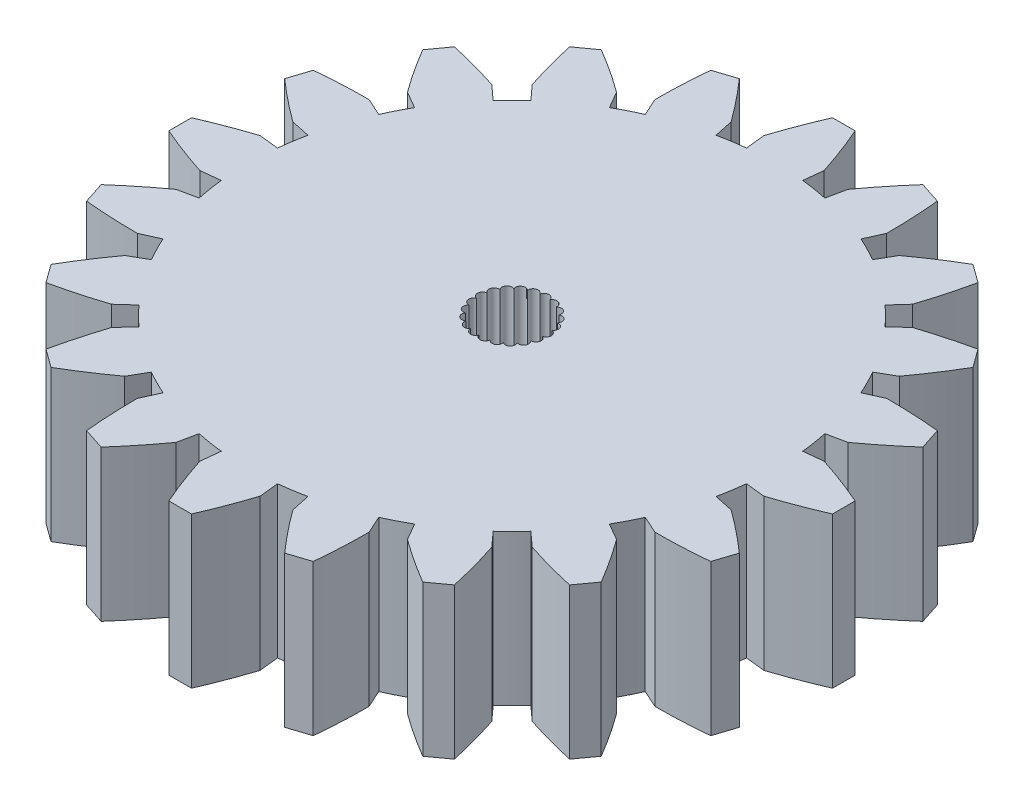
from build123d import *

# Parameters (mm, degrees)
BOSS_EXTRUDE1_DEPTH = 10


with BuildPart() as part:
    # Sketch2 → Boss-Extrude1 (new body)
    with BuildSketch(Plane(origin=(0, 0, 0), x_dir=(1, 0, 0), z_dir=(0, 1, 0))):
        with BuildLine():
            Line((1.862311102, 17.40062635), (2, 18.687131632))
            ThreePointArc((2, 18.687131632), (1.415225666, 20.352408535), (0.75, 21.987212193))
            Line((0.75, 21.987212193), (-0.75, 21.987212193))
            ThreePointArc((-0.75, 21.987212193), (-1.415225666, 20.352408535), (-2, 18.687131632))
            Line((-2, 18.687131632), (-1.862311102, 17.40062635))
            ThreePointArc((-1.862311102, 17.40062635), (-2.737603138, 17.28454596), (-3.605926146, 17.124464857))
            Line((-3.605926146, 17.124464857), (-3.872528218, 18.390552298))
            ThreePointArc((-3.872528218, 18.390552298), (-4.943280522, 19.793619541), (-6.081129839, 21.142844177))
            Line((-6.081129839, 21.142844177), (-7.507714614, 20.679318685))
            ThreePointArc((-7.507714614, 20.679318685), (-7.635199705, 18.918961978), (-7.676754283, 17.154484321))
            Line((-7.676754283, 17.154484321), (-7.148252364, 15.973493298))
            ThreePointArc((-7.148252364, 15.973493298), (-7.944833745, 15.592614173), (-8.721190219, 15.17204143))
            Line((-8.721190219, 15.17204143), (-9.365986392, 16.293777571))
            ThreePointArc((-9.365986392, 16.293777571), (-10.817903971, 17.297293156), (-12.31699632, 18.228867262))
            Line((-12.31699632, 18.228867262), (-13.530521812, 17.347189383))
            ThreePointArc((-13.530521812, 17.347189383), (-13.1077872, 15.633595606), (-12.60205437, 13.942636562))
            Line((-12.60205437, 13.942636562), (-11.734472879, 12.982763429))
            ThreePointArc((-11.734472879, 12.982763429), (-12.374368671, 12.374368671), (-12.982763429, 11.734472879))
            Line((-12.982763429, 11.734472879), (-13.942636562, 12.60205437))
            ThreePointArc((-13.942636562, 12.60205437), (-15.633595606, 13.1077872), (-17.347189383, 13.530521812))
            Line((-17.347189383, 13.530521812), (-18.228867262, 12.31699632))
            ThreePointArc((-18.228867262, 12.31699632), (-17.297293156, 10.817903971), (-16.293777571, 9.365986392))
            Line((-16.293777571, 9.365986392), (-15.17204143, 8.721190219))
            ThreePointArc((-15.17204143, 8.721190219), (-15.592614173, 7.944833745), (-15.973493298, 7.148252364))
            Line((-15.973493298, 7.148252364), (-17.154484321, 7.676754283))
            ThreePointArc((-17.154484321, 7.676754283), (-18.918961978, 7.635199705), (-20.679318685, 7.507714614))
            Line((-20.679318685, 7.507714614), (-21.142844177, 6.081129839))
            ThreePointArc((-21.142844177, 6.081129839), (-19.793619541, 4.943280522), (-18.390552298, 3.872528218))
            Line((-18.390552298, 3.872528218), (-17.124464857, 3.605926146))
            ThreePointArc((-17.124464857, 3.605926146), (-17.28454596, 2.737603138), (-17.40062635, 1.862311102))
            Line((-17.40062635, 1.862311102), (-18.687131632, 2))
            ThreePointArc((-18.687131632, 2), (-20.352408535, 1.415225666), (-21.987212193, 0.75))
            Line((-21.987212193, 0.75), (-21.987212193, -0.75))
            ThreePointArc((-21.987212193, -0.75), (-20.352408535, -1.415225666), (-18.687131632, -2))
            Line((-18.687131632, -2), (-17.40062635, -1.862311102))
            ThreePointArc((-17.40062635, -1.862311102), (-17.28454596, -2.737603138), (-17.124464857, -3.605926146))
            Line((-17.124464857, -3.605926146), (-18.390552298, -3.872528218))
            ThreePointArc((-18.390552298, -3.872528218), (-19.793619541, -4.943280522), (-21.142844177, -6.081129839))
            Line((-21.142844177, -6.081129839), (-20.679318685, -7.507714614))
            ThreePointArc((-20.679318685, -7.507714614), (-18.918961978, -7.635199706), (-17.154484321, -7.676754283))
            Line((-17.154484321, -7.676754283), (-15.973493298, -7.148252364))
            ThreePointArc((-15.973493298, -7.148252364), (-15.592614173, -7.944833745), (-15.17204143, -8.721190219))
            Line((-15.17204143, -8.721190219), (-16.293777571, -9.365986392))
            ThreePointArc((-16.293777571, -9.365986392), (-17.297293156, -10.817903971), (-18.228867262, -12.31699632))
            Line((-18.228867262, -12.31699632), (-17.347189383, -13.530521812))
            ThreePointArc((-17.347189383, -13.530521812), (-15.633595606, -13.1077872), (-13.942636562, -12.60205437))
            Line((-13.942636562, -12.60205437), (-12.982763429, -11.734472879))
            ThreePointArc((-12.982763429, -11.734472879), (-12.374368671, -12.374368671), (-11.734472879, -12.982763429))
            Line((-11.734472879, -12.982763429), (-12.60205437, -13.942636562))
            ThreePointArc((-12.60205437, -13.942636562), (-13.1077872, -15.633595606), (-13.530521812, -17.347189383))
            Line((-13.530521812, -17.347189383), (-12.31699632, -18.228867262))
            ThreePointArc((-12.31699632, -18.228867262), (-10.817903971, -17.297293156), (-9.365986392, -16.293777571))
            Line((-9.365986392, -16.293777571), (-8.721190219, -15.17204143))
            ThreePointArc((-8.721190219, -15.17204143), (-7.944833745, -15.592614173), (-7.148252364, -15.973493298))
            Line((-7.148252364, -15.973493298), (-7.676754283, -17.154484321))
            ThreePointArc((-7.676754283, -17.154484321), (-7.635199705, -18.918961978), (-7.507714614, -20.679318685))
            Line((-7.507714614, -20.679318685), (-6.081129839, -21.142844177))
            ThreePointArc((-6.081129839, -21.142844177), (-4.943280522, -19.793619541), (-3.872528218, -18.390552298))
            Line((-3.872528218, -18.390552298), (-3.605926146, -17.124464857))
            ThreePointArc((-3.605926146, -17.124464857), (-2.737603138, -17.28454596), (-1.862311102, -17.40062635))
            Line((-1.862311102, -17.40062635), (-2, -18.687131632))
            ThreePointArc((-2, -18.687131632), (-1.415225666, -20.352408535), (-0.75, -21.987212193))
            Line((-0.75, -21.987212193), (0.75, -21.987212193))
            ThreePointArc((0.75, -21.987212193), (1.415225666, -20.352408535), (2, -18.687131632))
            Line((2, -18.687131632), (1.862311102, -17.40062635))
            ThreePointArc((1.862311102, -17.40062635), (2.737603138, -17.28454596), (3.605926146, -17.124464857))
            Line((3.605926146, -17.124464857), (3.872528218, -18.390552298))
            ThreePointArc((3.872528218, -18.390552298), (4.943280522, -19.793619541), (6.081129839, -21.142844177))
            Line((6.081129839, -21.142844177), (7.507714614, -20.679318685))
            ThreePointArc((7.507714614, -20.679318685), (7.635199706, -18.918961978), (7.676754283, -17.154484321))
            Line((7.676754283, -17.154484321), (7.148252364, -15.973493298))
            ThreePointArc((7.148252364, -15.973493298), (7.944833745, -15.592614173), (8.721190219, -15.17204143))
            Line((8.721190219, -15.17204143), (9.365986392, -16.293777571))
            ThreePointArc((9.365986392, -16.293777571), (10.817903971, -17.297293156), (12.31699632, -18.228867262))
            Line((12.31699632, -18.228867262), (13.530521812, -17.347189383))
            ThreePointArc((13.530521812, -17.347189383), (13.1077872, -15.633595606), (12.60205437, -13.942636562))
            Line((12.60205437, -13.942636562), (11.734472879, -12.982763429))
            ThreePointArc((11.734472879, -12.982763429), (12.374368671, -12.374368671), (12.982763429, -11.734472879))
            Line((12.982763429, -11.734472879), (13.942636562, -12.60205437))
            ThreePointArc((13.942636562, -12.60205437), (15.633595606, -13.1077872), (17.347189383, -13.530521812))
            Line((17.347189383, -13.530521812), (18.228867262, -12.31699632))
            ThreePointArc((18.228867262, -12.31699632), (17.297293156, -10.817903971), (16.293777571, -9.365986392))
            Line((16.293777571, -9.365986392), (15.17204143, -8.721190219))
            ThreePointArc((15.17204143, -8.721190219), (15.592614173, -7.944833745), (15.973493298, -7.148252364))
            Line((15.973493298, -7.148252364), (17.154484321, -7.676754283))
            ThreePointArc((17.154484321, -7.676754283), (18.918961978, -7.635199705), (20.679318685, -7.507714614))
            Line((20.679318685, -7.507714614), (21.142844177, -6.081129839))
            ThreePointArc((21.142844177, -6.081129839), (19.793619541, -4.943280522), (18.390552298, -3.872528218))
            Line((18.390552298, -3.872528218), (17.124464857, -3.605926146))
            ThreePointArc((17.124464857, -3.605926146), (17.28454596, -2.737603138), (17.40062635, -1.862311102))
            Line((17.40062635, -1.862311102), (18.687131632, -2))
            ThreePointArc((18.687131632, -2), (20.352408535, -1.415225666), (21.987212193, -0.75))
            Line((21.987212193, -0.75), (21.987212193, 0.75))
            ThreePointArc((21.987212193, 0.75), (20.352408535, 1.415225666), (18.687131632, 2))
            Line((18.687131632, 2), (17.40062635, 1.862311102))
            ThreePointArc((17.40062635, 1.862311102), (17.28454596, 2.737603138), (17.124464857, 3.605926146))
            Line((17.124464857, 3.605926146), (18.390552298, 3.872528218))
            ThreePointArc((18.390552298, 3.872528218), (19.793619541, 4.943280522), (21.142844177, 6.081129839))
            Line((21.142844177, 6.081129839), (20.679318685, 7.507714614))
            ThreePointArc((20.679318685, 7.507714614), (18.918961978, 7.635199706), (17.154484321, 7.676754283))
            Line((17.154484321, 7.676754283), (15.973493298, 7.148252364))
            ThreePointArc((15.973493298, 7.148252364), (15.592614173, 7.944833745), (15.17204143, 8.721190219))
            Line((15.17204143, 8.721190219), (16.293777571, 9.365986392))
            ThreePointArc((16.293777571, 9.365986392), (17.297293156, 10.817903971), (18.228867262, 12.31699632))
            Line((18.228867262, 12.31699632), (17.347189383, 13.530521812))
            ThreePointArc((17.347189383, 13.530521812), (15.633595606, 13.1077872), (13.942636562, 12.60205437))
            Line((13.942636562, 12.60205437), (12.982763429, 11.734472879))
            ThreePointArc((12.982763429, 11.734472879), (12.374368671, 12.374368671), (11.734472879, 12.982763429))
            Line((11.734472879, 12.982763429), (12.60205437, 13.942636562))
            ThreePointArc((12.60205437, 13.942636562), (13.1077872, 15.633595606), (13.530521812, 17.347189383))
            Line((13.530521812, 17.347189383), (12.31699632, 18.228867262))
            ThreePointArc((12.31699632, 18.228867262), (10.817903971, 17.297293156), (9.365986392, 16.293777571))
            Line((9.365986392, 16.293777571), (8.721190219, 15.17204143))
            ThreePointArc((8.721190219, 15.17204143), (7.944833745, 15.592614173), (7.148252364, 15.973493298))
            Line((7.148252364, 15.973493298), (7.676754283, 17.154484321))
            ThreePointArc((7.676754283, 17.154484321), (7.635199705, 18.918961978), (7.507714614, 20.679318685))
            Line((7.507714614, 20.679318685), (6.081129839, 21.142844177))
            ThreePointArc((6.081129839, 21.142844177), (4.943280522, 19.793619541), (3.872528218, 18.390552298))
            Line((3.872528218, 18.390552298), (3.605926146, 17.124464857))
            ThreePointArc((3.605926146, 17.124464857), (2.737603138, 17.28454596), (1.862311102, 17.40062635))
        make_face()
        with BuildLine():
            ThreePointArc((2.144841407, 0.489546055), (2.443149303, 0.183088729), (2.193848354, -0.164406206))
            ThreePointArc((2.193848354, -0.164406206), (2.388573385, -0.545176288), (2.047922247, -0.803750254))
            ThreePointArc((2.047922247, -0.803750254), (2.121762239, -1.225), (1.720029261, -1.371677564))
            ThreePointArc((1.720029261, -1.371677564), (1.666423208, -1.795977086), (1.239304128, -1.817725303))
            ThreePointArc((1.239304128, -1.817725303), (1.063015161, -2.207373726), (0.648461384, -2.102260173))
            ThreePointArc((0.648461384, -2.102260173), (0.365153552, -2.422635524), (0, -2.2))
            ThreePointArc((0, -2.2), (-0.365153552, -2.422635524), (-0.648461384, -2.102260173))
            ThreePointArc((-0.648461384, -2.102260173), (-1.063015161, -2.207373726), (-1.239304128, -1.817725303))
            ThreePointArc((-1.239304128, -1.817725303), (-1.666423208, -1.795977086), (-1.720029261, -1.371677564))
            ThreePointArc((-1.720029261, -1.371677564), (-2.121762239, -1.225), (-2.047922247, -0.803750254))
            ThreePointArc((-2.047922247, -0.803750254), (-2.388573385, -0.545176288), (-2.193848354, -0.164406206))
            ThreePointArc((-2.193848354, -0.164406206), (-2.443149303, 0.183088729), (-2.144841407, 0.489546055))
            ThreePointArc((-2.144841407, 0.489546055), (-2.280640684, 0.89508551), (-1.905255888, 1.1))
            ThreePointArc((-1.905255888, 1.1), (-1.915487132, 1.527550015), (-1.496380023, 1.612714118))
            ThreePointArc((-1.496380023, 1.612714118), (-1.380134142, 2.024284997), (-0.954544226, 1.982131509))
            ThreePointArc((-0.954544226, 1.982131509), (-0.722150177, 2.341153374), (-0.327892986, 2.175427818))
            ThreePointArc((-0.327892986, 2.175427818), (0, 2.45), (0.327892986, 2.175427818))
            ThreePointArc((0.327892986, 2.175427818), (0.722150177, 2.341153374), (0.954544226, 1.982131509))
            ThreePointArc((0.954544226, 1.982131509), (1.380134142, 2.024284997), (1.496380023, 1.612714118))
            ThreePointArc((1.496380023, 1.612714118), (1.915487132, 1.527550015), (1.905255888, 1.1))
            ThreePointArc((1.905255888, 1.1), (2.280640684, 0.89508551), (2.144841407, 0.489546055))
        make_face(mode=Mode.SUBTRACT)
    extrude(amount=BOSS_EXTRUDE1_DEPTH)


solid = part.part
